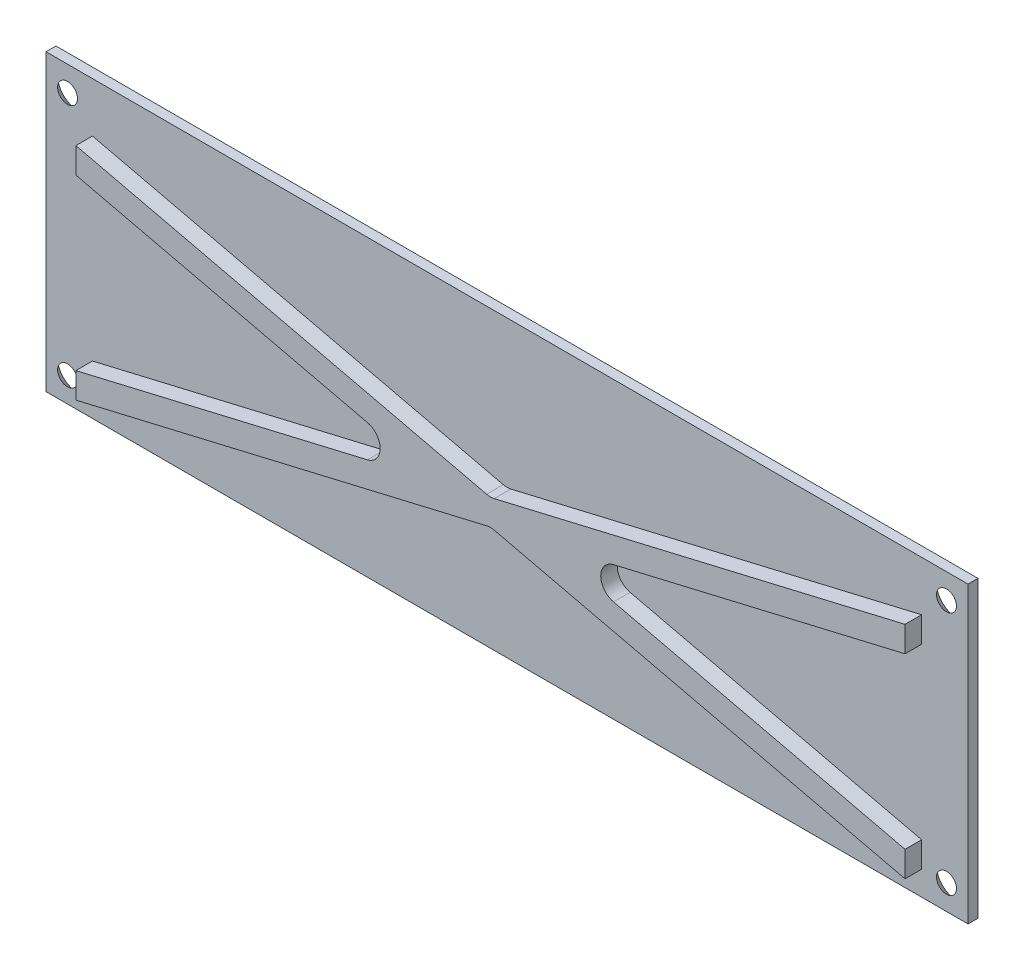
from build123d import *

# Parameters (mm, degrees)
SKETCH1_W                       = 112
SKETCH1_H                       = 35.5
BOSS_EXTRUDE1_DEPTH             = 1.2
SKETCH2_W                       = 6
SKETCH2_H                       = 6
BOSS_EXTRUDE2_DEPTH             = 2
SKETCH3_R                       = 1.1
CUT_EXTRUDE1_DEPTH              = 59.83283522
SKETCH7_W                       = 0.4
SKETCH7_H                       = 35.5
CUT_EXTRUDE5_DEPTH              = 59.83283522
AUFSATZ_LINEAR_AUSTRAGEN2_DEPTH = 2
VERRUNDUNG1_R                   = 2
SKETCH8_W                       = 5.6
SKETCH8_H                       = 35.5
CUT_EXTRUDE7_DEPTH              = 2
CHAMFER1_SIZE                   = 1.3


with BuildPart() as part:
    # Sketch1 → Boss-Extrude1 (new body)
    with BuildSketch(Plane.XY):
        Rectangle(SKETCH1_W, SKETCH1_H)
    extrude(amount=BOSS_EXTRUDE1_DEPTH)

    # Sketch2 → Boss-Extrude2 (add)
    with BuildSketch(Plane.XY.offset(1.2)):
        with Locations((-53, 14.75)):
            Rectangle(SKETCH2_W, SKETCH2_H)
        with Locations((-53, -14.75)):
            Rectangle(SKETCH2_W, SKETCH2_H)
        with Locations((53, -14.75)):
            Rectangle(SKETCH2_W, SKETCH2_H)
        with Locations((53, 14.75)):
            Rectangle(SKETCH2_W, SKETCH2_H)
    extrude(amount=BOSS_EXTRUDE2_DEPTH)

    # Sketch3 → Cut-Extrude1 (cut, through all)
    with BuildSketch(Plane.XY.offset(3.2)):
        with Locations((-53, 14.75)):
            Circle(SKETCH3_R)
        with Locations((-53, -14.75)):
            Circle(SKETCH3_R)
        with Locations((53, -14.75)):
            Circle(SKETCH3_R)
        with Locations((53, 14.75)):
            Circle(SKETCH3_R)
    extrude(amount=-CUT_EXTRUDE1_DEPTH, mode=Mode.SUBTRACT)

    # Sketch7 → Cut-Extrude5 (cut, through all)
    with BuildSketch(Plane(origin=(0, 0, 0), x_dir=(-1, 0, 0), z_dir=(0, 0, -1))):
        with Locations((-55.8, 0)):
            Rectangle(SKETCH7_W, SKETCH7_H)
        with Locations((55.8, 0)):
            Rectangle(SKETCH7_W, SKETCH7_H)
    extrude(amount=-CUT_EXTRUDE5_DEPTH, mode=Mode.SUBTRACT)

    # Skizze5 → Aufsatz-Linear austragen2 (add)
    with BuildSketch(Plane.XY.offset(1.2)):
        Polygon((-50, 11.75), (0, 0), (50, 11.75), (55.6, 11.75), (55.6, 9.984275645), (6.55686033, -1.540862177), (50, -11.75), (50, -14.831724355), (0, -3.081724355), (-50, -14.831724355), (-50, -11.75), (-6.55686033, -1.540862177), (-55.6, 9.984275645), (-55.6, 11.75), align=None)
    extrude(amount=AUFSATZ_LINEAR_AUSTRAGEN2_DEPTH)

    # Verrundung1
    verrundung1_edges = [part.edges().sort_by_distance(p)[0] for p in [
        (-6.55686033, -1.540862177, 2.2),
        (0, -3.081724355, 2.2),
        (6.55686033, -1.540862177, 2.2),
        (0, 0, 2.2),
    ]]
    fillet(verrundung1_edges, radius=VERRUNDUNG1_R)

    # Sketch8 → Cut-Extrude7 (cut)
    with BuildSketch(Plane.XY.offset(1.2)):
        with Locations((-52.8, 0)):
            Rectangle(SKETCH8_W, SKETCH8_H)
        with Locations((52.8, 0)):
            Rectangle(SKETCH8_W, SKETCH8_H)
    extrude(amount=CUT_EXTRUDE7_DEPTH, mode=Mode.SUBTRACT)

    # Chamfer1
    # the kernel refuses this chamfer: 1.3 mm, written as the material it takes off along each edge
    with BuildSketch(Plane(origin=(53, 14.75, 0), x_dir=(1, 0, 0), z_dir=(0, -1, 0))) as chamfer1_piece_1:
        Polygon((1.1, CHAMFER1_SIZE), (1.1 + CHAMFER1_SIZE, 0), (1.1, 0), align=None)
    revolve(axis=Axis((53, 14.75, 0), (0, 0, 1)), mode=Mode.SUBTRACT)
    with BuildSketch(Plane(origin=(-53, -14.75, 0), x_dir=(1, 0, 0), z_dir=(0, -1, 0))) as chamfer1_piece_2:
        Polygon((1.1 + CHAMFER1_SIZE, 0), (1.1, CHAMFER1_SIZE), (1.1, 0), align=None)
    revolve(axis=Axis((-53, -14.75, 0), (0, 0, 1)), mode=Mode.SUBTRACT)
    with BuildSketch(Plane(origin=(-53, 14.75, 0), x_dir=(1, 0, 0), z_dir=(0, -1, 0))) as chamfer1_piece_3:
        Polygon((1.1 + CHAMFER1_SIZE, 0), (1.1, CHAMFER1_SIZE), (1.1, 0), align=None)
    revolve(axis=Axis((-53, 14.75, 0), (0, 0, 1)), mode=Mode.SUBTRACT)
    with BuildSketch(Plane(origin=(53, -14.75, 0), x_dir=(1, 0, 0), z_dir=(0, -1, 0))) as chamfer1_piece_4:
        Polygon((1.1 + CHAMFER1_SIZE, 0), (1.1, CHAMFER1_SIZE), (1.1, 0), align=None)
    revolve(axis=Axis((53, -14.75, 0), (0, 0, 1)), mode=Mode.SUBTRACT)


solid = part.part
